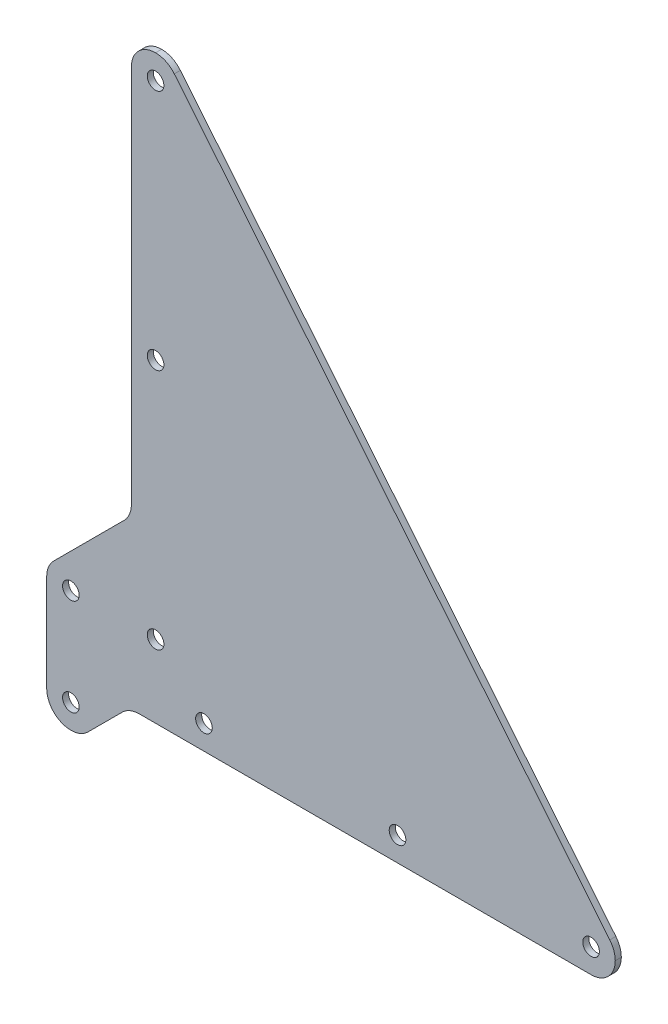
from build123d import *

# Parameters (mm, degrees)
SKETCH1_R           = 2.1828125
BOSS_EXTRUDE1_DEPTH = 0.79375
FILLET1_R           = 6.35


with BuildPart() as part:
    # Sketch1 → Boss-Extrude1 (new, symmetric)
    with BuildSketch(Plane.XY):
        Polygon((-28.575, 2.630256121), (-28.575, -31.75), (-19.594743879, -31.75), (-6.894743879, -19.05), (120.65, -19.05), (120.65, -10.433282549), (3.00913246, 133.35), (-6.35, 133.35), (-6.35, 24.855256121), align=None)
        Circle(SKETCH1_R, mode=Mode.SUBTRACT)
        with Locations((0, 63.5)):
            Circle(SKETCH1_R, mode=Mode.SUBTRACT)
        with Locations((12.7, -12.7)):
            Circle(SKETCH1_R, mode=Mode.SUBTRACT)
        with Locations((63.5, -12.7)):
            Circle(SKETCH1_R, mode=Mode.SUBTRACT)
        with Locations((-22.225, 0)):
            Circle(SKETCH1_R, mode=Mode.SUBTRACT)
        with Locations((-22.225, -25.4)):
            Circle(SKETCH1_R, mode=Mode.SUBTRACT)
        with Locations((0, 127)):
            Circle(SKETCH1_R, mode=Mode.SUBTRACT)
        with Locations((114.3, -12.7)):
            Circle(SKETCH1_R, mode=Mode.SUBTRACT)
    extrude(amount=BOSS_EXTRUDE1_DEPTH, both=True)

    # Fillet1
    fillet1_edges = [part.edges().sort_by_distance(p)[0] for p in [
        (120.65, -19.05, 0),
        (120.65, -10.433282549, 0),
        (-6.894743879, -19.05, 0),
        (-19.594743879, -31.75, 0),
        (-28.575, -31.75, 0),
        (-28.575, 2.630256121, 0),
        (-6.35, 24.855256121, 0),
        (3.00913246, 133.35, 0),
        (-6.35, 133.35, 0),
    ]]
    fillet(fillet1_edges, radius=FILLET1_R - 0.0001)  # a hair under: the kernel refuses the full size


solid = part.part
